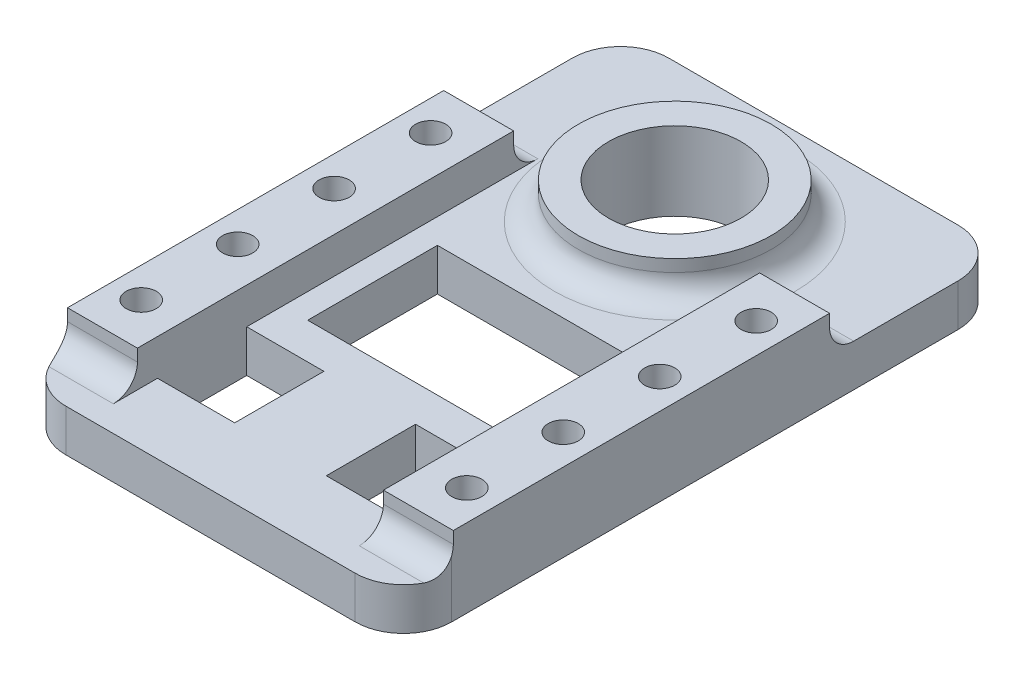
from build123d import *

# Parameters (mm, degrees)
SKETCH1_W                = 32
SKETCH1_H                = 50
SKETCH1_R                = 5.5
SKETCH1_R_2              = 1.25
BOSS_EXTRUDE1_DEPTH      = 3.5
FILETE1_R                = 4
ESBO_O1_R                = 8
ESBO_O1_R_2              = 5.5
ESBO_O1_W                = 5.8
ESBO_O1_H                = 31.201183342
RESSALTO_EXTRUS_O1_DEPTH = 3
ESBO_O3_W                = 16.288942458
ESBO_O3_H                = 10.757575704
CORTE_EXTRUS_O1_DEPTH    = 30.887288268
CORTE_EXTRUS_O2_REACH    = 32.385
ESBO_O4_R                = 1.25
FILETE2_R                = 2


with BuildPart() as part:
    # Sketch1 → Boss-Extrude1 (new body)
    with BuildSketch(Plane(origin=(0, 0, 0), x_dir=(1, 0, 0), z_dir=(0, 1, 0))):
        Rectangle(SKETCH1_W, SKETCH1_H)
        with Locations((0, 13.5)):
            Circle(SKETCH1_R, mode=Mode.SUBTRACT)
        with Locations((13.5, 6.75)):
            Circle(SKETCH1_R_2, mode=Mode.SUBTRACT)
        with Locations((13.5, -1.25)):
            Circle(SKETCH1_R_2, mode=Mode.SUBTRACT)
        with Locations((13.5, -9.25)):
            Circle(SKETCH1_R_2, mode=Mode.SUBTRACT)
        with Locations((13.5, -17.25)):
            Circle(SKETCH1_R_2, mode=Mode.SUBTRACT)
        with Locations((-13.5, -17.25)):
            Circle(SKETCH1_R_2, mode=Mode.SUBTRACT)
        with Locations((-13.5, -9.25)):
            Circle(SKETCH1_R_2, mode=Mode.SUBTRACT)
        with Locations((-13.5, -1.25)):
            Circle(SKETCH1_R_2, mode=Mode.SUBTRACT)
        with Locations((-13.5, 6.75)):
            Circle(SKETCH1_R_2, mode=Mode.SUBTRACT)
        Polygon((3.8, -15.5), (3.8, -11.8), (10.2, -11.8), (10.2, -19.2), (3.8, -19.2), align=None, mode=Mode.SUBTRACT)
        Polygon((-10.2, -19.2), (-3.8, -19.2), (-3.8, -15.5), (-3.8, -11.8), (-10.2, -11.8), align=None, mode=Mode.SUBTRACT)
    extrude(amount=BOSS_EXTRUDE1_DEPTH)

    # Filete1
    filete1_edges = [part.edges().sort_by_distance(p)[0] for p in [
        (16, 1.75, 25),
        (-16, 1.75, 25),
        (-16, 1.75, -25),
        (16, 1.75, -25),
    ]]
    fillet(filete1_edges, radius=FILETE1_R)

    # Esboço1 → Ressalto-extrusão1 (add)
    # profile 1 of 3: a face of its own
    with BuildSketch(Plane(origin=(0, 3.5, 0), x_dir=(1, 0, 0), z_dir=(0, 1, 0))):
        with Locations((0, 13.5)):
            Circle(ESBO_O1_R)
        with Locations((0, 13.5)):
            Circle(ESBO_O1_R_2, mode=Mode.SUBTRACT)
    # profile 2 of 3: a face of its own
    with BuildSketch(Plane(origin=(0, 3.5, 0), x_dir=(1, 0, 0), z_dir=(0, 1, 0))):
        with Locations((-13.1, -5.264208671)):
            Rectangle(ESBO_O1_W, ESBO_O1_H)
    # profile 3 of 3: a face of its own
    with BuildSketch(Plane(origin=(0, 3.5, 0), x_dir=(1, 0, 0), z_dir=(0, 1, 0))):
        with Locations((13.1, -5.264208671)):
            Rectangle(ESBO_O1_W, ESBO_O1_H)
    extrude(amount=RESSALTO_EXTRUS_O1_DEPTH)

    # Esboço3 → Corte-extrusão1 (cut, through all)
    with BuildSketch(Plane(origin=(0, 3.5, 0), x_dir=(1, 0, 0), z_dir=(0, 1, 0))):
        with Locations((0, -3.421212148)):
            Rectangle(ESBO_O3_W, ESBO_O3_H)
    extrude(amount=-CORTE_EXTRUS_O1_DEPTH, mode=Mode.SUBTRACT)

    # Esboço4 → Corte-extrusão2 (cut, up to next)
    with BuildSketch(Plane.XZ, mode=Mode.PRIVATE) as corte_extrus_o2_sk1:
        with Locations((-13.5, 17.25)):
            Circle(ESBO_O4_R)
    corte_extrus_o2_tool1 = extrude(corte_extrus_o2_sk1.sketch, amount=-CORTE_EXTRUS_O2_REACH, mode=Mode.PRIVATE) & part.part
    # Esboço4 → Corte-extrusão2 (cut, up to next)
    with BuildSketch(Plane.XZ, mode=Mode.PRIVATE) as corte_extrus_o2_sk2:
        with Locations((-13.5, 9.25)):
            Circle(ESBO_O4_R)
    corte_extrus_o2_tool2 = extrude(corte_extrus_o2_sk2.sketch, amount=-CORTE_EXTRUS_O2_REACH, mode=Mode.PRIVATE) & part.part
    # Esboço4 → Corte-extrusão2 (cut, up to next)
    with BuildSketch(Plane.XZ, mode=Mode.PRIVATE) as corte_extrus_o2_sk3:
        with Locations((-13.5, 1.25)):
            Circle(ESBO_O4_R)
    corte_extrus_o2_tool3 = extrude(corte_extrus_o2_sk3.sketch, amount=-CORTE_EXTRUS_O2_REACH, mode=Mode.PRIVATE) & part.part
    # Esboço4 → Corte-extrusão2 (cut, up to next)
    with BuildSketch(Plane.XZ, mode=Mode.PRIVATE) as corte_extrus_o2_sk4:
        with Locations((-13.5, -6.75)):
            Circle(ESBO_O4_R)
    corte_extrus_o2_tool4 = extrude(corte_extrus_o2_sk4.sketch, amount=-CORTE_EXTRUS_O2_REACH, mode=Mode.PRIVATE) & part.part
    # Esboço4 → Corte-extrusão2 (cut, up to next)
    with BuildSketch(Plane.XZ, mode=Mode.PRIVATE) as corte_extrus_o2_sk5:
        with Locations((13.5, 1.25)):
            Circle(ESBO_O4_R)
    corte_extrus_o2_tool5 = extrude(corte_extrus_o2_sk5.sketch, amount=-CORTE_EXTRUS_O2_REACH, mode=Mode.PRIVATE) & part.part
    # Esboço4 → Corte-extrusão2 (cut, up to next)
    with BuildSketch(Plane.XZ, mode=Mode.PRIVATE) as corte_extrus_o2_sk6:
        with Locations((13.5, 9.25)):
            Circle(ESBO_O4_R)
    corte_extrus_o2_tool6 = extrude(corte_extrus_o2_sk6.sketch, amount=-CORTE_EXTRUS_O2_REACH, mode=Mode.PRIVATE) & part.part
    # Esboço4 → Corte-extrusão2 (cut, up to next)
    with BuildSketch(Plane.XZ, mode=Mode.PRIVATE) as corte_extrus_o2_sk7:
        with Locations((13.5, 17.25)):
            Circle(ESBO_O4_R)
    corte_extrus_o2_tool7 = extrude(corte_extrus_o2_sk7.sketch, amount=-CORTE_EXTRUS_O2_REACH, mode=Mode.PRIVATE) & part.part
    # Esboço4 → Corte-extrusão2 (cut, up to next)
    with BuildSketch(Plane.XZ, mode=Mode.PRIVATE) as corte_extrus_o2_sk8:
        with Locations((13.5, -6.75)):
            Circle(ESBO_O4_R)
    corte_extrus_o2_tool8 = extrude(corte_extrus_o2_sk8.sketch, amount=-CORTE_EXTRUS_O2_REACH, mode=Mode.PRIVATE) & part.part
    add(corte_extrus_o2_tool1.solids().sort_by_distance((-13.5, 0, 17.25))[0], mode=Mode.SUBTRACT)
    add(corte_extrus_o2_tool2.solids().sort_by_distance((-13.5, 0, 9.25))[0], mode=Mode.SUBTRACT)
    add(corte_extrus_o2_tool3.solids().sort_by_distance((-13.5, 0, 1.25))[0], mode=Mode.SUBTRACT)
    add(corte_extrus_o2_tool4.solids().sort_by_distance((-13.5, 0, -6.75))[0], mode=Mode.SUBTRACT)
    add(corte_extrus_o2_tool5.solids().sort_by_distance((13.5, 0, 1.25))[0], mode=Mode.SUBTRACT)
    add(corte_extrus_o2_tool6.solids().sort_by_distance((13.5, 0, 9.25))[0], mode=Mode.SUBTRACT)
    add(corte_extrus_o2_tool7.solids().sort_by_distance((13.5, 0, 17.25))[0], mode=Mode.SUBTRACT)
    add(corte_extrus_o2_tool8.solids().sort_by_distance((13.5, 0, -6.75))[0], mode=Mode.SUBTRACT)

    # Filete2
    filete2_edges = [part.edges().sort_by_distance(p)[0] for p in [
        (-8, 3.5, -13.5),
        (13.1, 3.5, 20.864800342),
        (-13.1, 3.5, 20.864800342),
        (-13.1, 3.5, -10.336383),
        (13.1, 3.5, -10.336383),
    ]]
    fillet(filete2_edges, radius=FILETE2_R)


solid = part.part
